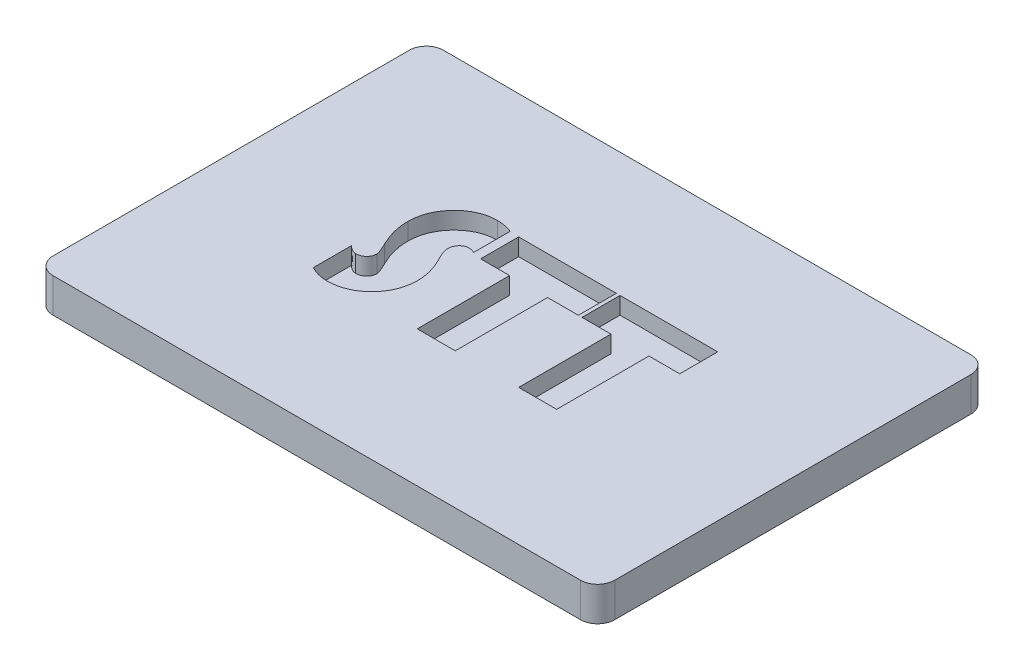
from build123d import *

# Parameters (mm, degrees)
SKETCH1_W           = 32.8
SKETCH1_H           = 22.8
BOSS_EXTRUDE1_DEPTH = 2
FILLET1_R           = 1
CUT_EXTRUDE1_DEPTH  = 1


with BuildPart() as part:
    # Sketch1 → Boss-Extrude1 (new body)
    with BuildSketch(Plane(origin=(0, 0, 0), x_dir=(1, 0, 0), z_dir=(0, 1, 0))):
        with Locations((16.4, 11.4)):
            Rectangle(SKETCH1_W, SKETCH1_H)
    extrude(amount=BOSS_EXTRUDE1_DEPTH)

    # Fillet1
    fillet1_edges = [part.edges().sort_by_distance(p)[0] for p in [
        (0, 1, -22.8),
        (32.8, 1, -22.8),
        (32.8, 1, 0),
        (0, 1, 0),
    ]]
    fillet(fillet1_edges, radius=FILLET1_R)

    # Sketch2 → Cut-Extrude1 (cut)
    with BuildSketch(Plane(origin=(0, 2, 0), x_dir=(1, 0, 0), z_dir=(0, 1, 0))):
        with BuildLine():
            Line((12.103669389, 15.588212785), (12.103669389, 13.462510817))
            add(Edge.make_bspline(
                [(12.103669389, 13.462510817), (12.067478164, 13.475119517), (11.999485838, 13.498807438), (11.902825223, 13.524429421), (11.819220361, 13.543594224), (11.767361344, 13.545755856), (11.743604875, 13.546746093)],
                knots=[0, 0, 0, 0, 1.237925225, 2.325685716, 3.233001373, 4, 4, 4, 4], degree=3))
            add(Edge.make_bspline(
                [(11.743604875, 13.546746093), (11.704213128, 13.544747386), (11.626409193, 13.540799674), (11.515264032, 13.5023983), (11.413284829, 13.440703726), (11.322657643, 13.357416549), (11.246986203, 13.257257504), (11.191005288, 13.144920434), (11.159374222, 13.021555746), (11.154701285, 12.936352871), (11.15230627, 12.892683949)],
                knots=[0, 0, 0, 0, 0.963368211, 1.902780206, 2.847611186, 3.870376157, 4.902016381, 5.910508887, 6.929075774, 8, 8, 8, 8], degree=3))
            add(Edge.make_bspline(
                [(11.15230627, 12.892683949), (11.15494117, 12.85121414), (11.160596524, 12.762206396), (11.196833346, 12.622832478), (11.251552483, 12.467862827), (11.302052911, 12.362588312), (11.329035183, 12.306340361)],
                knots=[0, 0, 0, 0, 0.806548219, 1.731115713, 2.787739919, 4, 4, 4, 4], degree=3))
            Line((11.329035183, 12.306340361), (11.480989014, 12.002432698))
            add(Edge.make_bspline(
                [(11.480989014, 12.002432698), (11.513536687, 11.934444257), (11.577742801, 11.800324882), (11.662079456, 11.597114589), (11.733408397, 11.395368804), (11.791392984, 11.195204542), (11.836455238, 10.996679116), (11.867058786, 10.800156819), (11.888566792, 10.605590355), (11.891027745, 10.476344982), (11.892255362, 10.411872484)],
                knots=[0, 0, 0, 0, 1.091274604, 2.152734579, 3.183918567, 4.18803247, 5.168547751, 6.129191744, 7.06676982, 8, 8, 8, 8], degree=3))
            add(Edge.make_bspline(
                [(11.892255362, 10.411872484), (11.890225491, 10.319811484), (11.886234258, 10.138796556), (11.848968389, 9.87257458), (11.7871313, 9.618136518), (11.705779366, 9.372853513), (11.594665045, 9.140936753), (11.462303763, 8.918016389), (11.304584517, 8.706541227), (11.12575761, 8.508278481), (10.930218444, 8.327288301), (10.721786317, 8.167515195), (10.501561069, 8.03381528), (10.271033103, 7.923175105), (10.030138854, 7.837614737), (9.778422655, 7.776154585), (9.516075498, 7.738855663), (9.337242235, 7.734881747), (9.246276689, 7.732860369)],
                knots=[0, 0, 0, 0, 1.053025029, 2.070510305, 3.068320851, 4.046527558, 5.021625387, 6.004830255, 7.00906403, 8.035056499, 9.055988148, 10.053937905, 11.035000932, 11.998716703, 12.975116181, 13.954559623, 14.959563797, 16, 16, 16, 16], degree=3))
            add(Edge.make_bspline(
                [(9.246276689, 7.732860369), (9.15737082, 7.735867692), (8.979182335, 7.741895083), (8.713145876, 7.796831496), (8.448152575, 7.881331106), (8.278615751, 7.963601867), (8.192509902, 8.005386262)],
                knots=[0, 0, 0, 0, 0.970033745, 1.944178097, 2.955871129, 4, 4, 4, 4], degree=3))
            Line((8.192509902, 8.005386262), (8.192509902, 10.225233539))
            add(Edge.make_bspline(
                [(8.192509902, 10.225233539), (8.239360411, 10.184176873), (8.326844527, 10.107511621), (8.464042527, 10.021318896), (8.593353454, 9.963617797), (8.679277497, 9.956180114), (8.719393295, 9.952707646)],
                knots=[0, 0, 0, 0, 1.232278927, 2.301038614, 3.206797186, 4, 4, 4, 4], degree=3))
            add(Edge.make_bspline(
                [(8.719393295, 9.952707646), (8.763072091, 9.9550561), (8.847761486, 9.959609549), (8.970006261, 9.99147408), (9.079760325, 10.046708338), (9.176034752, 10.12153861), (9.256059824, 10.212425828), (9.314481099, 10.317019556), (9.348992402, 10.433983951), (9.353137752, 10.515141043), (9.355287046, 10.557219627)],
                knots=[0, 0, 0, 0, 1.069499973, 2.073667633, 3.068739384, 4.058680921, 5.043096131, 6.014962219, 6.970791368, 8, 8, 8, 8], degree=3))
            add(Edge.make_bspline(
                [(9.355287046, 10.557219627), (9.353993911, 10.5732392), (9.35102175, 10.61005883), (9.336318039, 10.671177476), (9.315251067, 10.745339397), (9.283376584, 10.831283487), (9.24041635, 10.92869113), (9.194107325, 11.041092621), (9.135695208, 11.164785236), (9.092335481, 11.250480108), (9.069547776, 11.295517047)],
                knots=[0, 0, 0, 0, 0.484238432, 1.112981033, 1.890960445, 2.8104886, 3.874776843, 5.102625601, 6.477284912, 8, 8, 8, 8], degree=3))
            add(Edge.make_bspline(
                [(9.069547776, 11.295517047), (9.033489259, 11.370577397), (8.962137311, 11.519105476), (8.870718297, 11.74559598), (8.789324611, 11.970644468), (8.727749512, 12.197526783), (8.677743114, 12.424035557), (8.641289959, 12.650053805), (8.618764973, 12.876254743), (8.616481513, 13.026968628), (8.615337954, 13.102446303)],
                knots=[0, 0, 0, 0, 1.062729974, 2.102911069, 3.116516653, 4.11571732, 5.10138035, 6.076564273, 7.036741329, 8, 8, 8, 8], degree=3))
            add(Edge.make_bspline(
                [(8.615337954, 13.102446303), (8.617374488, 13.191763492), (8.621402125, 13.368405389), (8.658949616, 13.627812323), (8.718714197, 13.877686492), (8.800892673, 14.118407163), (8.909835089, 14.348957713), (9.039927599, 14.570795718), (9.195510347, 14.78216903), (9.372301671, 14.981267002), (9.564876472, 15.164537181), (9.768891596, 15.326311523), (9.983003732, 15.462709256), (10.206808123, 15.57362623), (10.439734455, 15.660677849), (10.682504581, 15.720848377), (10.934047885, 15.761052579), (11.105351026, 15.764732921), (11.1919464, 15.76659337)],
                knots=[0, 0, 0, 0, 1.04134106, 2.059451963, 3.050112589, 4.035116009, 5.020558971, 6.01953182, 7.030426816, 8.076805362, 9.121606136, 10.127593448, 11.109241514, 12.077117541, 13.036218445, 14.003476409, 14.990738247, 16, 16, 16, 16], degree=3))
            add(Edge.make_bspline(
                [(11.1919464, 15.76659337), (11.26913802, 15.764225264), (11.423662557, 15.759484719), (11.65386646, 15.725511903), (11.881797356, 15.669538692), (12.029240242, 15.615494357), (12.103669389, 15.588212785)],
                knots=[0, 0, 0, 0, 0.991240117, 1.984294677, 2.982472252, 4, 4, 4, 4], degree=3))
        make_face()
        Polygon((16.543363942, 13.335332067), (16.543363942, 7.944274395), (14.323516665, 7.944274395), (14.323516665, 13.335332067), (12.632204454, 13.335332067), (12.632204454, 15.555179343), (18.340383165, 15.555179343), (18.340383165, 13.335332067), align=None)
        Polygon((22.462956679, 13.335332067), (22.462956679, 7.944274395), (20.243109402, 7.944274395), (20.243109402, 13.335332067), (18.551797192, 13.335332067), (18.551797192, 15.555179343), (24.259975903, 15.555179343), (24.259975903, 13.335332067), align=None)
    extrude(amount=-CUT_EXTRUDE1_DEPTH, mode=Mode.SUBTRACT)


solid = part.part
